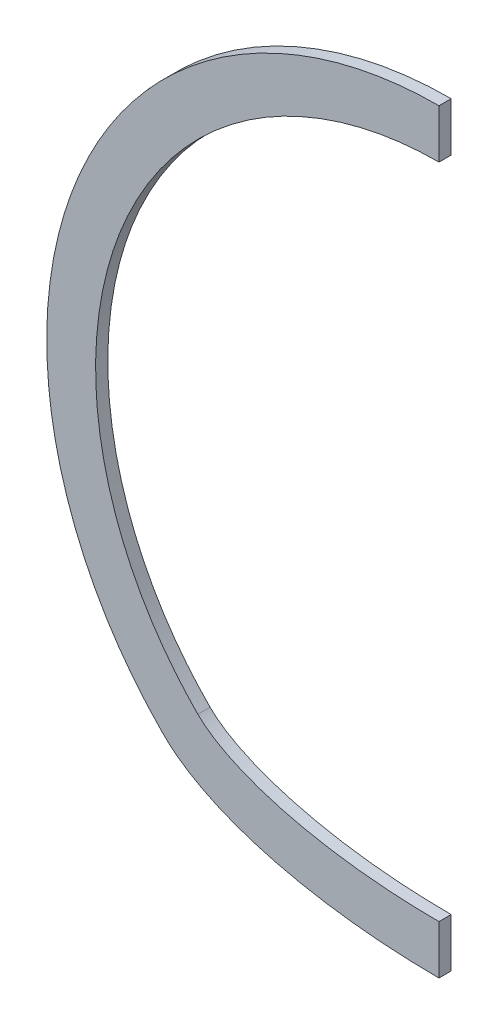
from build123d import *

# Parameters (mm, degrees)
BOSS_EXTRUDE1_DEPTH = 3.175
SKETCH3_W           = 129.389558459
SKETCH3_H           = 294.720660933
CUT_EXTRUDE1_DEPTH  = 146.946732918


with BuildPart() as part:
    # Sketch2 → Boss-Extrude1 (new body)
    with BuildSketch(Plane.XY):
        with BuildLine():
            add(Edge.make_bspline(
                [(-71.677392112, -72.91043434), (-72.109242456, -72.4766599), (-72.972872043, -71.593614958), (-74.469591152, -70.002616718), (-75.837182996, -68.488043391), (-77.186084408, -66.931897067), (-78.515677479, -65.334729876), (-79.824432739, -63.69624614), (-81.54760822, -61.446428575), (-83.64161213, -58.529673548), (-85.629566809, -55.501403393), (-87.162218254, -52.997335562), (-88.285911427, -51.070131488), (-90.114728738, -47.772436811), (-92.549922179, -42.891387424), (-95.3516338, -36.175158441), (-97.806777615, -28.854790192), (-99.416568113, -22.492651102), (-100.484378106, -16.973479224), (-101.217383692, -12.115821661), (-101.805900705, -6.108471449), (-102.055561509, 1.055644647), (-101.63758347, 11.916616183), (-99.581715265, 24.703392789), (-94.947787628, 39.477591596), (-88.656512854, 52.708120751), (-80.043367163, 65.554146484), (-69.871244821, 76.755385293), (-58.636991603, 85.914826096), (-47.202028885, 92.898966836), (-35.790499648, 98.052224226), (-24.000842482, 101.716725174), (-12.029496563, 103.894248368), (-3.656941748, 104.395312689), (0.99110515, 104.372307848), (2.644688984, 104.347784008), (5.295920706, 104.255895368), (8.944129249, 104.002381094), (12.923536456, 103.566176285), (16.897932891, 102.969160213), (20.860675893, 102.210568115), (24.80503533, 101.28991654), (28.724197829, 100.207008268), (32.611281662, 98.961940132), (36.459348765, 97.555109249), (39.942943882, 96.118550993), (42.44327487, 94.981609399), (43.99462248, 94.237634049), (44.922549304, 93.78091779), (45.846607961, 93.314294304), (46.766722746, 92.837849145), (47.682656642, 92.351383169), (48.561810847, 91.873519084), (49.188310006, 91.524412896), (49.500915025, 91.348034768)],
                knots=[0, 0, 0, 0, 0.006795371, 0.013653749, 0.020575359, 0.027560428, 0.034609183, 0.041721853, 0.048898669, 0.063445664, 0.078252032, 0.085753069, 0.093319659, 0.100952039, 0.124124286, 0.148784986, 0.174947707, 0.20262677, 0.215493637, 0.232144402, 0.252599943, 0.276885796, 0.305032091, 0.363115877, 0.408011314, 0.462235121, 0.511576331, 0.564908162, 0.615597651, 0.658548959, 0.700915758, 0.742691235, 0.783870362, 0.824449909, 0.827808956, 0.831171349, 0.841278604, 0.854801757, 0.868378359, 0.882008332, 0.895691582, 0.909427999, 0.923217451, 0.937059793, 0.95095486, 0.964902468, 0.975397534, 0.978902417, 0.982410558, 0.985921952, 0.989436598, 0.99295449, 0.996475625, 1, 1, 1, 1], degree=3))
            add(Edge.make_bspline(
                [(49.500915025, 91.348034768), (49.872005924, 91.138482333), (50.241810712, 90.926750039), (50.610303013, 90.712853821)],
                knots=[0, 0, 0, 0, 1, 1, 1, 1], degree=3))
            add(Edge.make_bspline(
                [(50.610303013, 90.712853821), (51.128442093, 90.411846037), (52.167202685, 89.796039228), (53.932536969, 88.703576387), (55.579762788, 87.638711627), (57.218137155, 86.533145805), (58.847026669, 85.387425363), (60.465187486, 84.201108463), (62.61485058, 82.559008476), (65.268683437, 80.403244909), (68.38020159, 77.661045558), (71.420405526, 74.753669295), (74.379227375, 71.68115848), (77.246352549, 68.444125522), (79.542797672, 65.619898893), (81.324264236, 63.280297585), (82.635173495, 61.479754257), (83.915139631, 59.639466174), (85.682600666, 56.976700672), (87.896856718, 53.369477174), (90.462597049, 48.676901727), (92.889220315, 43.626105667), (95.132677705, 38.215723181), (97.146538959, 32.44823322), (98.88212407, 26.330630408), (100.289240179, 19.875099059), (101.25863273, 13.473856941), (101.817336128, 7.24671143), (102.015185645, 1.305015561), (101.87858065, -4.624237286), (101.39263307, -10.734726225), (100.537146292, -16.867570025), (99.329398352, -22.86381348), (97.893600846, -28.372193875), (96.656960211, -32.269847721), (95.785564151, -34.744415114), (95.0459628, -36.764317914), (93.953188789, -39.535816997), (92.43580554, -43.007047711), (90.821696456, -46.36490671), (89.118620831, -49.608230444), (87.334164726, -52.736260206), (85.475724639, -55.748623833), (83.55049497, -58.64531039), (81.56545684, -61.42664709), (79.307705413, -64.380683017), (77.436977348, -66.647222523), (76.007346494, -68.288860963), (75.29509586, -69.089727056), (74.579038656, -69.87823774), (73.859443089, -70.654502436), (73.136338858, -71.418398838), (72.317504882, -72.264736672), (71.891235125, -72.69667798), (71.678426975, -72.91043429)],
                knots=[0, 0, 0, 0, 0.010157109, 0.020393378, 0.030708694, 0.04110294, 0.051575992, 0.062127721, 0.072757993, 0.094253595, 0.116061609, 0.138180754, 0.160609666, 0.183346893, 0.206390897, 0.218027437, 0.229740057, 0.241528542, 0.253392669, 0.280162256, 0.30828042, 0.337739229, 0.368530108, 0.400643849, 0.434070605, 0.468799897, 0.504820602, 0.536144777, 0.567394405, 0.598569553, 0.629670285, 0.664058743, 0.696204476, 0.726123241, 0.753829745, 0.760691378, 0.767515904, 0.787767528, 0.807687634, 0.827278023, 0.846540474, 0.865476741, 0.88408856, 0.902377642, 0.920345676, 0.937994331, 0.961031903, 0.966703489, 0.972340071, 0.97794171, 0.983508463, 0.989040391, 0.99453755, 1, 1, 1, 1], degree=3))
            add(Edge.make_bspline(
                [(71.678426975, -72.91043429), (46.359928794, -98.341734638), (-46.358893881, -98.341734638), (-71.677392112, -72.91043434)],
                knots=[0, 0, 0, 0, 1, 1, 1, 1], degree=3, weights=[1, 1, 1, 1]))
        make_face()
        with BuildLine():
            add(Edge.make_bspline(
                [(-62.677197057, -63.950161522), (-62.895509204, -63.730876692), (-63.321725733, -63.298342375), (-64.002059554, -62.592101669), (-64.753829554, -61.794622516), (-65.703931611, -60.764569773), (-66.804574903, -59.527416198), (-68.556788175, -57.468052236), (-70.648178443, -54.835505477), (-73.811350461, -50.469012961), (-77.394544541, -44.756057433), (-82.302878117, -35.13540616), (-86.810757895, -22.360038108), (-90.354277409, -0.967371821), (-87.649941962, 26.350088977), (-73.333390238, 55.972118358), (-49.623996274, 78.708841275), (-24.487235723, 89.383519301), (-3.090994932, 92.115890306), (13.038963103, 91.197514401), (26.120286031, 87.996586306), (34.879374941, 84.524845656), (39.102105625, 82.510352052), (41.214271269, 81.410816796), (42.347028641, 80.797644792), (42.959233617, 80.456937494), (43.258169219, 80.288282027)],
                knots=[0, 0, 0, 0, 0.003906217, 0.007812434, 0.01171865, 0.015624867, 0.023437301, 0.031249734, 0.046874602, 0.062499469, 0.093749203, 0.124998938, 0.187498407, 0.249997875, 0.374996813, 0.499995751, 0.624994688, 0.749993626, 0.812493095, 0.874992564, 0.937492033, 0.968741767, 0.984366634, 0.992179068, 0.996085285, 0.999991501, 0.999991501, 0.999991501, 0.999991501], degree=3))
            add(Edge.make_bspline(
                [(43.258169219, 80.288282027), (43.339663738, 80.24226006), (43.502520945, 80.149972739), (43.746371392, 80.01083423), (43.989796594, 79.870982545), (44.151786326, 79.777278604), (44.232713854, 79.73030574)],
                knots=[0.002022438, 0.002022438, 0.002022438, 0.002022438, 0.251013535, 0.500004632, 0.748995729, 0.997986827, 0.997986827, 0.997986827, 0.997986827], degree=3))
            add(Edge.make_bspline(
                [(44.232713854, 79.73030574), (44.58444416, 79.525959484), (45.259622085, 79.127643656), (46.415361761, 78.422292298), (47.573803007, 77.692810893), (49.007921659, 76.758403592), (50.804832808, 75.530634538), (53.607223777, 73.493209173), (57.003409969, 70.790302329), (64.764138566, 63.842060668), (74.853642347, 51.769295456), (84.311822541, 33.000711524), (89.302574517, 12.581832114), (89.594071681, -8.463887057), (85.167338267, -29.022546245), (78.471156755, -43.288686452), (72.737789819, -52.004533398), (70.145497848, -55.492337454), (67.954788222, -58.18874646), (66.537169113, -59.834423786), (65.376799992, -61.124092609), (64.636118066, -61.923784826), (64.04885936, -62.544039678), (63.540759488, -63.072130947), (63.065749199, -63.559376825), (62.8132246, -63.814567336), (62.678231924, -63.950161468)],
                knots=[1.4601e-05, 1.4601e-05, 1.4601e-05, 1.4601e-05, 0.007826987, 0.015639373, 0.023451759, 0.031264145, 0.046888916, 0.062513688, 0.093763232, 0.125012776, 0.250010951, 0.375009125, 0.5000073, 0.625005475, 0.75000365, 0.875001825, 0.906251369, 0.937500913, 0.953125684, 0.968750456, 0.976562842, 0.984375228, 0.988281421, 0.992187614, 0.996093807, 1, 1, 1, 1], degree=3))
            add(Edge.make_bspline(
                [(62.678231924, -63.950161468), (62.442110433, -64.187331736), (61.973465348, -64.632177633), (60.848308103, -65.594894105), (59.178943877, -66.825880953), (56.737455869, -68.325151322), (52.942333804, -70.28884928), (47.260951473, -72.599488515), (39.221466424, -74.977986937), (30.229046438, -76.880115217), (17.304785319, -78.721740765), (0.000517457, -79.658688067), (-17.303750406, -78.721740765), (-30.228011525, -76.880115217), (-39.22043151, -74.977986937), (-47.25991656, -72.599488515), (-52.941298891, -70.28884928), (-56.736420955, -68.325151322), (-59.177908963, -66.825880953), (-60.84727319, -65.594894105), (-61.972430435, -64.632177633), (-62.441075519, -64.187331736), (-62.677197057, -63.950161522)],
                knots=[0, 0, 0, 0, 0.015625, 0.03125, 0.0625, 0.09375, 0.125, 0.1875, 0.25, 0.3125, 0.375, 0.5, 0.625, 0.6875, 0.75, 0.8125, 0.875, 0.90625, 0.9375, 0.96875, 0.984375, 1, 1, 1, 1], degree=3))
        make_face(mode=Mode.SUBTRACT)
    extrude(amount=-BOSS_EXTRUDE1_DEPTH)

    # Sketch3 → Cut-Extrude1 (cut, through all)
    with BuildSketch(Plane(origin=(0, 0, 0), x_dir=(0, 0, -1), z_dir=(1, 0, 0))):
        with Locations((3.684090068, 10.698040846)):
            Rectangle(SKETCH3_W, SKETCH3_H)
    extrude(amount=CUT_EXTRUDE1_DEPTH, mode=Mode.SUBTRACT)


solid = part.part
